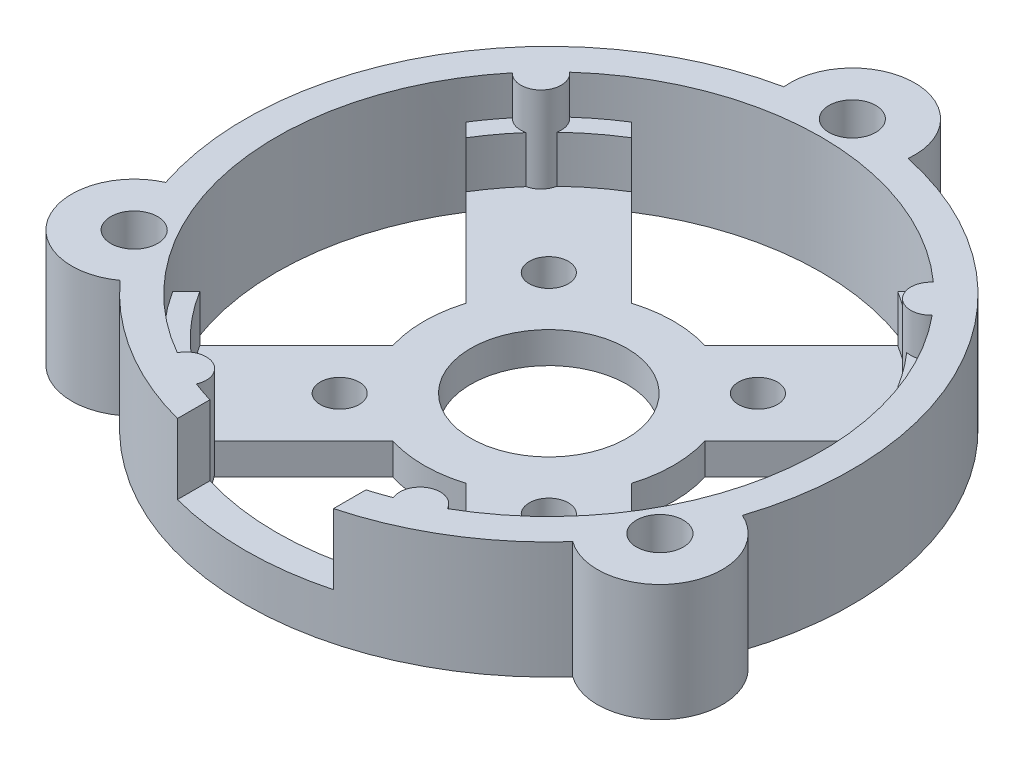
from build123d import *

# Parameters (mm, degrees)
ESQUISSE1_R                                = 19.45
ESQUISSE1_R_2                              = 17.45
BOSS_EXTRU_1_DEPTH                         = 7.5
BOSS_EXTRU_2_START                         = -2
ESQUISSE2_R                                = 1.25
BOSS_EXTRU_2_DEPTH                         = 2
BOSS_EXTRU_3_START                         = 3
BOSS_EXTRU_3_DEPTH                         = 3
BOSS_EXTRU_4_REACH                         = 30.051
CHANFREIN1_SIZE                            = 1.258649447
CHANFREIN1_SIZE_2                          = 1.5
ENL_V_MAT_EXTRU_1_DEPTH                    = 7.5
BOSS_EXTRU_5_START                         = -7.5
BOSS_EXTRU_5_DEPTH                         = 7.5
R_P_TITION_CIRCULAIRE1_COUNT               = 2
R_P_TITION_CIRCULAIRE1_ANGLE               = 120
R_P_TITION_CIRCULAIRE1_THE_OTHER_WAY_COUNT = 2
R_P_TITION_CIRCULAIRE1_THE_OTHER_WAY_ANGLE = 120
ESQUISSE6_W                                = 10
ESQUISSE6_H                                = 5
ENL_V_MAT_EXTRU_2_DEPTH                    = 4.5


with BuildPart() as part:
    # Esquisse1 → Boss.-Extru.1 (new body)
    with BuildSketch(Plane(origin=(0, 0, 0), x_dir=(1, 0, 0), z_dir=(0, 1, 0))):
        with Locations(Location((0, 0, 0), (0, 0, 270))):
            Circle(ESQUISSE1_R)
        with Locations(Location((0, 0, 0), (0, 0, 270))):
            Circle(ESQUISSE1_R_2, mode=Mode.SUBTRACT)
    extrude(amount=-BOSS_EXTRU_1_DEPTH)

    # Esquisse2 → Boss.-Extru.2 (add)
    # profile 1 of 16: a face of its own
    with BuildSketch(Plane(origin=(0, -7.5, 0), x_dir=(-1, 0, 0), z_dir=(0, -1, 0)).offset(BOSS_EXTRU_2_START)):
        with BuildLine():
            Line((2.345223593, -7.648524452), (9.39907569, -14.702376549))
            ThreePointArc((9.39907569, -14.702376549), (12.339013332, -12.339013332), (14.702376549, -9.39907569))
            Line((14.702376549, -9.39907569), (7.648524452, -2.345223593))
            ThreePointArc((7.648524452, -2.345223593), (5.656854249, -5.656854249), (2.345223593, -7.648524452))
        make_face()
        with Locations(Location((6.7, -6.7, 0), (0, 0, 90))):
            Circle(ESQUISSE2_R, mode=Mode.SUBTRACT)
    # profile 2 of 16: a face of its own
    with BuildSketch(Plane(origin=(0, -7.5, 0), x_dir=(-1, 0, 0), z_dir=(0, -1, 0)).offset(BOSS_EXTRU_2_START)):
        with BuildLine():
            Line((5.303300859, 0), (7.648524452, -2.345223593))
            ThreePointArc((7.648524452, -2.345223593), (7.91164318, -1.185707464), (8, 0))
            ThreePointArc((8, 0), (7.91164318, 1.185707464), (7.648524452, 2.345223593))
            Line((7.648524452, 2.345223593), (5.303300859, 0))
        make_face()
    # profile 3 of 16: a face of its own
    with BuildSketch(Plane(origin=(0, -7.5, 0), x_dir=(-1, 0, 0), z_dir=(0, -1, 0)).offset(BOSS_EXTRU_2_START)):
        with BuildLine():
            Line((0.313114563, -4.990186296), (0, -5.303300859))
            Line((0, -5.303300859), (2.345223593, -7.648524452))
            ThreePointArc((2.345223593, -7.648524452), (5.656854249, -5.656854249), (7.648524452, -2.345223593))
            Line((7.648524452, -2.345223593), (5.303300859, 0))
            Line((5.303300859, 0), (4.990186296, -0.313114563))
            ThreePointArc((4.990186296, -0.313114563), (3.535533906, -3.535533906), (0.313114563, -4.990186296))
        make_face()
    # profile 4 of 16: a face of its own
    with BuildSketch(Plane(origin=(0, -7.5, 0), x_dir=(-1, 0, 0), z_dir=(0, -1, 0)).offset(BOSS_EXTRU_2_START)):
        with BuildLine():
            Line((4.990186296, 0.313114563), (5.303300859, 0))
            Line((5.303300859, 0), (7.648524452, 2.345223593))
            ThreePointArc((7.648524452, 2.345223593), (5.656854249, 5.656854249), (2.345223593, 7.648524452))
            Line((2.345223593, 7.648524452), (0, 5.303300859))
            Line((0, 5.303300859), (0.313114563, 4.990186296))
            ThreePointArc((0.313114563, 4.990186296), (3.535533906, 3.535533906), (4.990186296, 0.313114563))
        make_face()
    # profile 5 of 16: a face of its own
    with BuildSketch(Plane(origin=(0, -7.5, 0), x_dir=(-1, 0, 0), z_dir=(0, -1, 0)).offset(BOSS_EXTRU_2_START)):
        with BuildLine():
            ThreePointArc((5, 0), (4.997545972, -0.156634158), (4.990186296, -0.313114563))
            Line((4.990186296, -0.313114563), (5.303300859, 0))
            Line((5.303300859, 0), (4.990186296, 0.313114563))
            ThreePointArc((4.990186296, 0.313114563), (4.997545972, 0.156634158), (5, 0))
        make_face()
    # profile 6 of 16: a face of its own
    with BuildSketch(Plane(origin=(0, -7.5, 0), x_dir=(-1, 0, 0), z_dir=(0, -1, 0)).offset(BOSS_EXTRU_2_START)):
        with BuildLine():
            ThreePointArc((14.702376549, 9.39907569), (12.339013332, 12.339013332), (9.39907569, 14.702376549))
            Line((9.39907569, 14.702376549), (2.345223593, 7.648524452))
            ThreePointArc((2.345223593, 7.648524452), (5.656854249, 5.656854249), (7.648524452, 2.345223593))
            Line((7.648524452, 2.345223593), (14.702376549, 9.39907569))
        make_face()
        with Locations(Location((6.7, 6.7, 0), (0, 0, 90))):
            Circle(ESQUISSE2_R, mode=Mode.SUBTRACT)
    # profile 7 of 16: a face of its own
    with BuildSketch(Plane(origin=(0, -7.5, 0), x_dir=(-1, 0, 0), z_dir=(0, -1, 0)).offset(BOSS_EXTRU_2_START)):
        with BuildLine():
            Line((0, 5.303300859), (-0.313114563, 4.990186296))
            ThreePointArc((-0.313114563, 4.990186296), (0, 5), (0.313114563, 4.990186296))
            Line((0.313114563, 4.990186296), (0, 5.303300859))
        make_face()
    # profile 8 of 16: a face of its own
    with BuildSketch(Plane(origin=(0, -7.5, 0), x_dir=(-1, 0, 0), z_dir=(0, -1, 0)).offset(BOSS_EXTRU_2_START)):
        with BuildLine():
            Line((-7.648524452, 2.345223593), (-5.303300859, 0))
            Line((-5.303300859, 0), (-4.990186296, 0.313114563))
            ThreePointArc((-4.990186296, 0.313114563), (-3.535533906, 3.535533906), (-0.313114563, 4.990186296))
            Line((-0.313114563, 4.990186296), (0, 5.303300859))
            Line((0, 5.303300859), (-2.345223593, 7.648524452))
            ThreePointArc((-2.345223593, 7.648524452), (-5.656854249, 5.656854249), (-7.648524452, 2.345223593))
        make_face()
    # profile 9 of 16: a face of its own
    with BuildSketch(Plane(origin=(0, -7.5, 0), x_dir=(-1, 0, 0), z_dir=(0, -1, 0)).offset(BOSS_EXTRU_2_START)):
        with BuildLine():
            Line((-4.990186296, 0.313114563), (-5.303300859, 0))
            Line((-5.303300859, 0), (-4.990186296, -0.313114563))
            ThreePointArc((-4.990186296, -0.313114563), (-5, 0), (-4.990186296, 0.313114563))
        make_face()
    # profile 10 of 16: a face of its own
    with BuildSketch(Plane(origin=(0, -7.5, 0), x_dir=(-1, 0, 0), z_dir=(0, -1, 0)).offset(BOSS_EXTRU_2_START)):
        with BuildLine():
            ThreePointArc((-7.648524452, -2.345223593), (-5.656854249, -5.656854249), (-2.345223593, -7.648524452))
            Line((-2.345223593, -7.648524452), (0, -5.303300859))
            Line((0, -5.303300859), (-0.313114563, -4.990186296))
            ThreePointArc((-0.313114563, -4.990186296), (-3.535533906, -3.535533906), (-4.990186296, -0.313114563))
            Line((-4.990186296, -0.313114563), (-5.303300859, 0))
            Line((-5.303300859, 0), (-7.648524452, -2.345223593))
        make_face()
    # profile 11 of 16: a face of its own
    with BuildSketch(Plane(origin=(0, -7.5, 0), x_dir=(-1, 0, 0), z_dir=(0, -1, 0)).offset(BOSS_EXTRU_2_START)):
        with BuildLine():
            ThreePointArc((-7.648524452, 2.345223593), (-8, 0), (-7.648524452, -2.345223593))
            Line((-7.648524452, -2.345223593), (-5.303300859, 0))
            Line((-5.303300859, 0), (-7.648524452, 2.345223593))
        make_face()
    # profile 12 of 16: a face of its own
    with BuildSketch(Plane(origin=(0, -7.5, 0), x_dir=(-1, 0, 0), z_dir=(0, -1, 0)).offset(BOSS_EXTRU_2_START)):
        with BuildLine():
            Line((-0.313114563, -4.990186296), (0, -5.303300859))
            Line((0, -5.303300859), (0.313114563, -4.990186296))
            ThreePointArc((0.313114563, -4.990186296), (0, -5), (-0.313114563, -4.990186296))
        make_face()
    # profile 13 of 16: a face of its own
    with BuildSketch(Plane(origin=(0, -7.5, 0), x_dir=(-1, 0, 0), z_dir=(0, -1, 0)).offset(BOSS_EXTRU_2_START)):
        with BuildLine():
            Line((0, -5.303300859), (-2.345223593, -7.648524452))
            ThreePointArc((-2.345223593, -7.648524452), (0, -8), (2.345223593, -7.648524452))
            Line((2.345223593, -7.648524452), (0, -5.303300859))
        make_face()
    # profile 14 of 16: a face of its own
    with BuildSketch(Plane(origin=(0, -7.5, 0), x_dir=(-1, 0, 0), z_dir=(0, -1, 0)).offset(BOSS_EXTRU_2_START)):
        with BuildLine():
            ThreePointArc((2.345223593, 7.648524452), (0, 8), (-2.345223593, 7.648524452))
            Line((-2.345223593, 7.648524452), (0, 5.303300859))
            Line((0, 5.303300859), (2.345223593, 7.648524452))
        make_face()
    # profile 15 of 16: a face of its own
    with BuildSketch(Plane(origin=(0, -7.5, 0), x_dir=(-1, 0, 0), z_dir=(0, -1, 0)).offset(BOSS_EXTRU_2_START)):
        with BuildLine():
            ThreePointArc((-9.39907569, 14.702376549), (-12.339013332, 12.339013332), (-14.702376549, 9.39907569))
            Line((-14.702376549, 9.39907569), (-7.648524452, 2.345223593))
            ThreePointArc((-7.648524452, 2.345223593), (-5.656854249, 5.656854249), (-2.345223593, 7.648524452))
            Line((-2.345223593, 7.648524452), (-9.39907569, 14.702376549))
        make_face()
        with Locations(Location((-6.7, 6.7, 0), (0, 0, 90))):
            Circle(ESQUISSE2_R, mode=Mode.SUBTRACT)
    # profile 16 of 16: a face of its own
    with BuildSketch(Plane(origin=(0, -7.5, 0), x_dir=(-1, 0, 0), z_dir=(0, -1, 0)).offset(BOSS_EXTRU_2_START)):
        with BuildLine():
            ThreePointArc((-14.702376549, -9.39907569), (-12.339013332, -12.339013332), (-9.39907569, -14.702376549))
            Line((-9.39907569, -14.702376549), (-2.345223593, -7.648524452))
            ThreePointArc((-2.345223593, -7.648524452), (-5.656854249, -5.656854249), (-7.648524452, -2.345223593))
            Line((-7.648524452, -2.345223593), (-14.702376549, -9.39907569))
        make_face()
        with Locations(Location((-6.7, -6.7, 0), (0, 0, 90))):
            Circle(ESQUISSE2_R, mode=Mode.SUBTRACT)
    extrude(amount=BOSS_EXTRU_2_DEPTH)

    # Esquisse3 → Boss.-Extru.3 (add)
    with BuildSketch(Plane(origin=(0, -5.5, 0), x_dir=(1, 0, 0), z_dir=(0, 1, 0)).offset(BOSS_EXTRU_3_START)):
        with BuildLine():
            ThreePointArc((-13.831990317, 8.528689458), (-11.490485194, 11.490485194), (-8.528689458, 13.831990317))
            Line((-8.528689458, 13.831990317), (-9.39907569, 14.702376549))
            ThreePointArc((-9.39907569, 14.702376549), (-12.339013332, 12.339013332), (-14.702376549, 9.39907569))
            Line((-14.702376549, 9.39907569), (-13.831990317, 8.528689458))
        make_face()
        with BuildLine():
            Line((9.39907569, 14.702376549), (8.528689458, 13.831990317))
            ThreePointArc((8.528689458, 13.831990317), (11.490485194, 11.490485194), (13.831990317, 8.528689458))
            Line((13.831990317, 8.528689458), (14.702376549, 9.39907569))
            ThreePointArc((14.702376549, 9.39907569), (12.339013332, 12.339013332), (9.39907569, 14.702376549))
        make_face()
        with BuildLine():
            ThreePointArc((-8.528689458, -13.831990317), (-11.490485194, -11.490485194), (-13.831990317, -8.528689458))
            Line((-13.831990317, -8.528689458), (-14.702376549, -9.39907569))
            ThreePointArc((-14.702376549, -9.39907569), (-12.339013332, -12.339013332), (-9.39907569, -14.702376549))
            Line((-9.39907569, -14.702376549), (-8.528689458, -13.831990317))
        make_face()
        with BuildLine():
            Line((14.702376549, -9.39907569), (13.831990317, -8.528689458))
            ThreePointArc((13.831990317, -8.528689458), (11.490485194, -11.490485194), (8.528689458, -13.831990317))
            Line((8.528689458, -13.831990317), (9.39907569, -14.702376549))
            ThreePointArc((9.39907569, -14.702376549), (12.339013332, -12.339013332), (14.702376549, -9.39907569))
        make_face()
    extrude(amount=-BOSS_EXTRU_3_DEPTH)

    # Boss.-Extru.4: up to this face of the body (flat: up to its plane)
    boss_extru_4_end = Plane(part.part.faces().sort_by_distance((0, 0, -18.899870924))[0])
    # Esquisse4 → Boss.-Extru.4 (add, up to the picked face)
    with BuildSketch(Plane(origin=(0, -5.5, 0), x_dir=(1, 0, 0), z_dir=(0, 1, 0)), mode=Mode.PRIVATE) as boss_extru_4_sk1:
        with BuildLine():
            ThreePointArc((-12.198982549, 10.735330678), (-11.722543967, 11.253642208), (-11.22410238, 11.750830854))
            ThreePointArc((-11.22410238, 11.750830854), (-11.272234731, 12.42730837), (-11.65450707, 12.987492636))
            ThreePointArc((-11.65450707, 12.987492636), (-12.588208752, 12.084680402), (-13.452174862, 11.114922019))
            ThreePointArc((-13.452174862, 11.114922019), (-12.876860571, 10.75582312), (-12.198982549, 10.735330678))
        make_face()
    boss_extru_4_tool1 = split(extrude(boss_extru_4_sk1.sketch, amount=BOSS_EXTRU_4_REACH, mode=Mode.PRIVATE), bisect_by=boss_extru_4_end, keep=Keep.BOTH, mode=Mode.PRIVATE)
    # Esquisse4 → Boss.-Extru.4 (add, up to the picked face)
    with BuildSketch(Plane(origin=(0, -5.5, 0), x_dir=(1, 0, 0), z_dir=(0, 1, 0)), mode=Mode.PRIVATE) as boss_extru_4_sk2:
        with BuildLine():
            ThreePointArc((-12.198982549, 10.735330678), (-11.562196483, 11.099708623), (-11.22410238, 11.750830854))
            ThreePointArc((-11.22410238, 11.750830854), (-11.722543967, 11.253642208), (-12.198982549, 10.735330678))
        make_face()
    boss_extru_4_tool2 = split(extrude(boss_extru_4_sk2.sketch, amount=BOSS_EXTRU_4_REACH, mode=Mode.PRIVATE), bisect_by=boss_extru_4_end, keep=Keep.BOTH, mode=Mode.PRIVATE)
    # Esquisse4 → Boss.-Extru.4 (add, up to the picked face)
    with BuildSketch(Plane(origin=(0, -5.5, 0), x_dir=(1, 0, 0), z_dir=(0, 1, 0)), mode=Mode.PRIVATE) as boss_extru_4_sk3:
        with BuildLine():
            ThreePointArc((12.198982549, 10.735330678), (11.722543967, 11.253642208), (11.22410238, 11.750830854))
            ThreePointArc((11.22410238, 11.750830854), (11.562196483, 11.099708623), (12.198982549, 10.735330678))
        make_face()
    boss_extru_4_tool3 = split(extrude(boss_extru_4_sk3.sketch, amount=BOSS_EXTRU_4_REACH, mode=Mode.PRIVATE), bisect_by=boss_extru_4_end, keep=Keep.BOTH, mode=Mode.PRIVATE)
    # Esquisse4 → Boss.-Extru.4 (add, up to the picked face)
    with BuildSketch(Plane(origin=(0, -5.5, 0), x_dir=(1, 0, 0), z_dir=(0, 1, 0)), mode=Mode.PRIVATE) as boss_extru_4_sk4:
        with BuildLine():
            ThreePointArc((11.65450707, 12.987492636), (11.272234731, 12.42730837), (11.22410238, 11.750830854))
            ThreePointArc((11.22410238, 11.750830854), (11.722543967, 11.253642208), (12.198982549, 10.735330678))
            ThreePointArc((12.198982549, 10.735330678), (12.876860571, 10.75582312), (13.452174862, 11.114922019))
            ThreePointArc((13.452174862, 11.114922019), (12.588208752, 12.084680402), (11.65450707, 12.987492636))
        make_face()
    boss_extru_4_tool4 = split(extrude(boss_extru_4_sk4.sketch, amount=BOSS_EXTRU_4_REACH, mode=Mode.PRIVATE), bisect_by=boss_extru_4_end, keep=Keep.BOTH, mode=Mode.PRIVATE)
    # Esquisse4 → Boss.-Extru.4 (add, up to the picked face)
    with BuildSketch(Plane(origin=(0, -5.5, 0), x_dir=(1, 0, 0), z_dir=(0, 1, 0)), mode=Mode.PRIVATE) as boss_extru_4_sk5:
        with BuildLine():
            ThreePointArc((6.308439087, -16.269790911), (7.502340978, -15.754916053), (8.654592336, -15.152575078))
            ThreePointArc((8.654592336, -15.152575078), (6.941086345, -14.576281326), (6.308439087, -16.269790911))
        make_face()
    boss_extru_4_tool5 = split(extrude(boss_extru_4_sk5.sketch, amount=BOSS_EXTRU_4_REACH, mode=Mode.PRIVATE), bisect_by=boss_extru_4_end, keep=Keep.BOTH, mode=Mode.PRIVATE)
    # Esquisse4 → Boss.-Extru.4 (add, up to the picked face)
    with BuildSketch(Plane(origin=(0, -5.5, 0), x_dir=(1, 0, 0), z_dir=(0, 1, 0)), mode=Mode.PRIVATE) as boss_extru_4_sk6:
        with BuildLine():
            ThreePointArc((-6.308439087, -16.269790911), (-6.941086345, -14.576281326), (-8.654592336, -15.152575078))
            ThreePointArc((-8.654592336, -15.152575078), (-7.502340978, -15.754916053), (-6.308439087, -16.269790911))
        make_face()
    boss_extru_4_tool6 = split(extrude(boss_extru_4_sk6.sketch, amount=BOSS_EXTRU_4_REACH, mode=Mode.PRIVATE), bisect_by=boss_extru_4_end, keep=Keep.BOTH, mode=Mode.PRIVATE)
    add(boss_extru_4_tool1.solids().sort_by(Axis((-12.181108, -5.5, -11.693863), (0, 1, 0)))[0])
    add(boss_extru_4_tool2.solids().sort_by(Axis((-11.655738, -5.5, -11.189508), (0, 1, 0)))[0])
    add(boss_extru_4_tool3.solids().sort_by(Axis((11.655738, -5.5, -11.189508), (0, 1, 0)))[0])
    add(boss_extru_4_tool4.solids().sort_by(Axis((12.181108, -5.5, -11.693863), (0, 1, 0)))[0])
    add(boss_extru_4_tool5.solids().sort_by(Axis((7.260346, -5.5, 15.246726), (0, 1, 0)))[0])
    add(boss_extru_4_tool6.solids().sort_by(Axis((-7.260346, -5.5, 15.246726), (0, 1, 0)))[0])

    # Chanfrein1
    # the kernel refuses this chamfer: 1.5, 1.258649447 mm, written as the material it adds along each edge
    with BuildSketch(Plane(origin=(0, -5.5, 0), x_dir=(-0.6746573052433168, 0, 0.738131099793137), z_dir=(-0.738131099793137, 0, -0.6746573052433168))) as chanfrein1_piece_1_section:
        Polygon((17.45, -CHANFREIN1_SIZE), (17.45 - CHANFREIN1_SIZE_2, 0), (17.45, 0), align=None)
    chanfrein1_piece_1 = revolve(axis=Axis((0, -5.5, 0), (0, 1, 0)), revolution_arc=33.928397159, mode=Mode.PRIVATE)
    chanfrein1_piece_1 = chanfrein1_piece_1 & Plane(origin=(-7.5, -5.952007583, 15.75), x_dir=(0.9165853175591765, 0, 0.39983916220768523), z_dir=(0, -1, 0)) * Cylinder(1.3, 70, mode=Mode.PRIVATE)
    add(chanfrein1_piece_1)
    with BuildSketch(Plane(origin=(0, -5.5, 0), x_dir=(0.14779467805019864, 0, 0.9890180651232), z_dir=(-0.9890180651232, 0, 0.14779467805019864))) as chanfrein1_piece_2_section:
        Polygon((17.45, -CHANFREIN1_SIZE), (17.45 - CHANFREIN1_SIZE_2, 0), (17.45, 0), align=None)
    chanfrein1_piece_2 = revolve(axis=Axis((0, -5.5, 0), (0, 1, 0)), revolution_arc=33.928397159, mode=Mode.PRIVATE)
    chanfrein1_piece_2 = chanfrein1_piece_2 & Plane(origin=(7.5, -5.952007583, 15.75), x_dir=(0.8881479508593404, 0, -0.45955763227734), z_dir=(0, -1, 0)) * Cylinder(1.3, 70, mode=Mode.PRIVATE)
    add(chanfrein1_piece_2)

    # Esquisse5 → Enlèv. mat.-Extru.1 (cut)
    with BuildSketch(Plane(origin=(0, 0, 0), x_dir=(1, 0, 0), z_dir=(0, 1, 0))):
        with BuildLine():
            ThreePointArc((-1.498884406, 19.392159383), (-1.040009393, 18.369083508), (0, 17.95))
            Line((0, 17.95), (0, 19.45))
            ThreePointArc((0, 19.45), (-0.75, 19.435534467), (-1.498884406, 19.392159383))
        make_face()
        with BuildLine():
            Line((0, 19.45), (0, 17.95))
            ThreePointArc((0, 17.95), (1.040009393, 18.369083508), (1.498884406, 19.392159383))
            ThreePointArc((1.498884406, 19.392159383), (0.75, 19.435534467), (0, 19.45))
        make_face()
    enl_v_mat_extru_1 = extrude(amount=-ENL_V_MAT_EXTRU_1_DEPTH, mode=Mode.SUBTRACT)

    # Esquisse5<3> → Boss.-Extru.5 (add)
    with BuildSketch(Plane(origin=(0, 0, 0), x_dir=(1, 0, 0), z_dir=(0, 1, 0)).offset(BOSS_EXTRU_5_START)):
        with BuildLine():
            ThreePointArc((-1.498884406, 19.392159383), (-0.028925687, 20.949721076), (1.5, 19.45))
            ThreePointArc((1.5, 19.45), (1.499721076, 19.421074313), (1.498884406, 19.392159383))
            ThreePointArc((1.498884406, 19.392159383), (2.744536924, 19.255389299), (3.978796705, 19.038688946))
            ThreePointArc((3.978796705, 19.038688946), (3.994695659, 19.244071394), (4, 19.45))
            ThreePointArc((4, 19.45), (-0.205928606, 23.444695659), (-3.978796705, 19.038688946))
            ThreePointArc((-3.978796705, 19.038688946), (-2.744536924, 19.255389299), (-1.498884406, 19.392159383))
        make_face()
    boss_extru_5 = extrude(amount=BOSS_EXTRU_5_DEPTH)

    # Répétition circulaire1: Enlèv. mat.-Extru.1, Boss.-Extru.5 ×2 about axis
    r_p_tition_circulaire1_axis = Axis((0, -7.5, 0), (0, 1, 0))
    add([enl_v_mat_extru_1.rotate(r_p_tition_circulaire1_axis, i * R_P_TITION_CIRCULAIRE1_ANGLE / (R_P_TITION_CIRCULAIRE1_COUNT - 1)) for i in range(1, R_P_TITION_CIRCULAIRE1_COUNT)], mode=Mode.SUBTRACT)
    add([boss_extru_5.rotate(r_p_tition_circulaire1_axis, i * R_P_TITION_CIRCULAIRE1_ANGLE / (R_P_TITION_CIRCULAIRE1_COUNT - 1)) for i in range(1, R_P_TITION_CIRCULAIRE1_COUNT)])

    # Répétition circulaire1 the other way: Enlèv. mat.-Extru.1, Boss.-Extru.5 ×2 about axis
    r_p_tition_circulaire1_the_other_way_axis = Axis((0, -7.5, 0), (0, -1, 0))
    add([enl_v_mat_extru_1.rotate(r_p_tition_circulaire1_the_other_way_axis, i * R_P_TITION_CIRCULAIRE1_THE_OTHER_WAY_ANGLE / (R_P_TITION_CIRCULAIRE1_THE_OTHER_WAY_COUNT - 1)) for i in range(1, R_P_TITION_CIRCULAIRE1_THE_OTHER_WAY_COUNT)], mode=Mode.SUBTRACT)
    add([boss_extru_5.rotate(r_p_tition_circulaire1_the_other_way_axis, i * R_P_TITION_CIRCULAIRE1_THE_OTHER_WAY_ANGLE / (R_P_TITION_CIRCULAIRE1_THE_OTHER_WAY_COUNT - 1)) for i in range(1, R_P_TITION_CIRCULAIRE1_THE_OTHER_WAY_COUNT)])

    # Esquisse6 → Enlèv. mat.-Extru.2 (cut)
    with BuildSketch(Plane(origin=(0, 0, 0), x_dir=(1, 0, 0), z_dir=(0, 1, 0))):
        with Locations((0, -17.45)):
            Rectangle(ESQUISSE6_W, ESQUISSE6_H)
    extrude(amount=-ENL_V_MAT_EXTRU_2_DEPTH, mode=Mode.SUBTRACT)


solid = part.part
